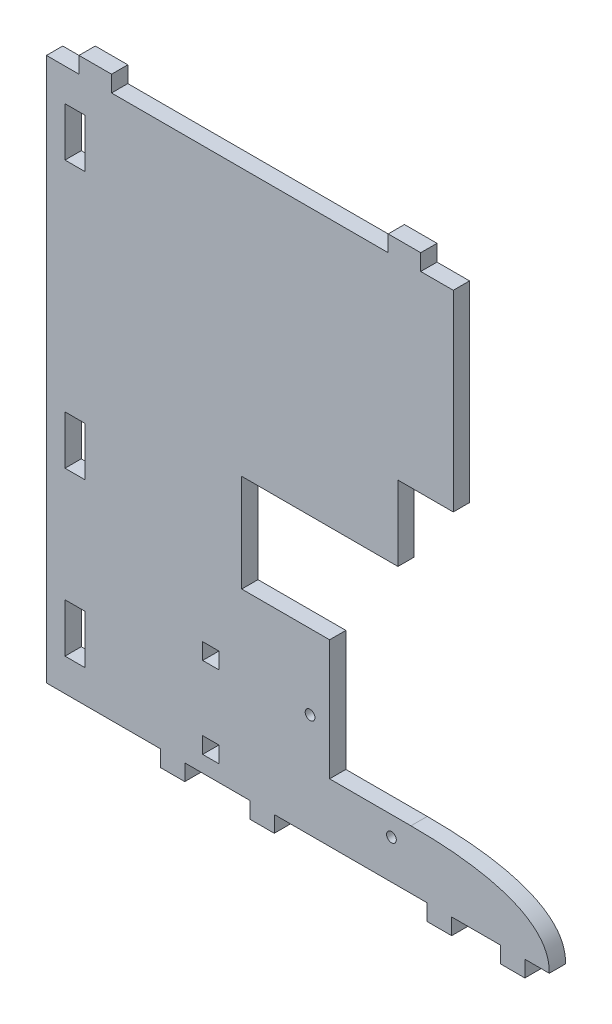
from build123d import *

# Parameters (mm, degrees)
ESQUISSE1_R        = 1.5
BOSS_EXTRU_1_DEPTH = 5
ESQUISSE2_W        = 6.138933528
ESQUISSE2_H        = 15
ESQUISSE2_W_2      = 5
ESQUISSE2_H_2      = 5
BOSS_EXTRU_2_DEPTH = 5


with BuildPart() as part:
    # Esquisse1 → Boss.-Extru.1 (new body)
    with BuildSketch(Plane.XY):
        Polygon((0, 0), (37, 0), (37, 18), (12, 18), (12, 55), (0, 55), align=None)
        with Locations((6, 32)):
            Circle(ESQUISSE1_R, mode=Mode.SUBTRACT)
        with Locations((31, 12)):
            Circle(ESQUISSE1_R, mode=Mode.SUBTRACT)
    extrude(amount=BOSS_EXTRU_1_DEPTH)

    # Esquisse2 → Boss.-Extru.2 (add)
    # profile 1 of 2: a face of its own
    with BuildSketch(Plane.XY.offset(5)):
        with BuildLine():
            Line((37, 0), (42, 0))
            Line((42, 0), (42, -5))
            Line((42, -5), (49.5, -5))
            Line((49.5, -5), (49.5, 0))
            Line((49.5, 0), (64.5, 0))
            Line((64.5, 0), (64.5, -5))
            Line((64.5, -5), (72, -5))
            Line((72, -5), (72, 0))
            Line((72, 0), (79.5, 0))
            add(Edge.make_bspline(
                [(37, 18), (79.239532327, 18), (79.5, 3.874285435), (79.5, 0)],
                knots=[0, 0, 0, 0, 1, 1, 1, 1], degree=3))
            Line((37, 18), (37, 0))
        make_face()
    # profile 2 of 2: a face of its own
    with BuildSketch(Plane.XY.offset(5)):
        Polygon((0, 0), (-5, 0), (-5, -5), (-12.5, -5), (-12.5, 0), (-32.5, 0), (-32.5, -5), (-40, -5), (-40, 0), (-75, 0), (-75, 167), (-65, 167), (-65, 172), (-55, 172), (-55, 167), (30, 167), (30, 172), (40, 172), (40, 167), (50, 167), (50, 108), (33, 108), (33, 85), (-15, 85), (-15, 55), (0, 55), align=None)
        with Locations((-66.228617731, 17.5)):
            Rectangle(ESQUISSE2_W, ESQUISSE2_H, mode=Mode.SUBTRACT)
        with Locations((-66.228617731, 67.5)):
            Rectangle(ESQUISSE2_W, ESQUISSE2_H, mode=Mode.SUBTRACT)
        with Locations((-66.228617731, 149.5)):
            Rectangle(ESQUISSE2_W, ESQUISSE2_H, mode=Mode.SUBTRACT)
        with Locations((-24.5, 7.5)):
            Rectangle(ESQUISSE2_W_2, ESQUISSE2_H_2, mode=Mode.SUBTRACT)
        with Locations((-24.5, 32.5)):
            Rectangle(ESQUISSE2_W_2, ESQUISSE2_H_2, mode=Mode.SUBTRACT)
    extrude(amount=-BOSS_EXTRU_2_DEPTH)


solid = part.part
